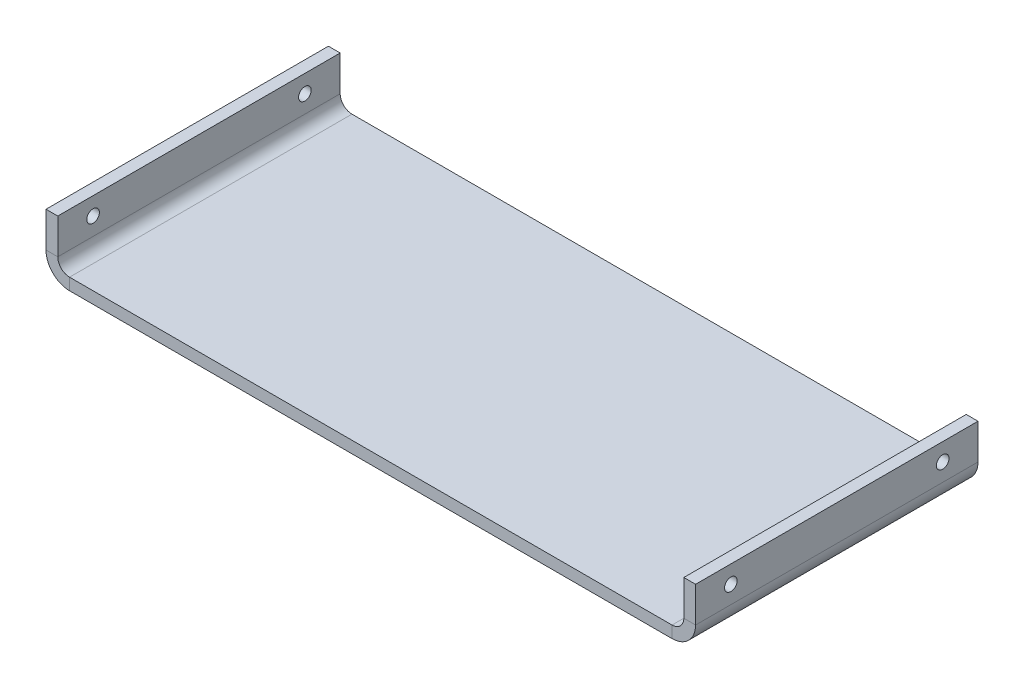
from build123d import *

# Parameters (mm, degrees)
SKETCH1_W                      = 175.26
SKETCH1_H                      = 76.2
BOSS_EXTRUDE1_DEPTH            = 3.175
EDGE_FLANGE1_STRIP_W           = 19.05
EDGE_FLANGE1_STRIP_H           = 3.175
EDGE_FLANGE1_STRIP_CUT_DEPTH   = 76.2
EDGE_FLANGE1_STRIP_2_W         = 19.05
EDGE_FLANGE1_STRIP_2_H         = 3.175
EDGE_FLANGE1_STRIP_CUT_2_DEPTH = 76.2
EDGE_FLANGE1_DEPTH             = 76.2
EDGE_FLANGE1_BEND_DEPTH        = 76.2
M3_CLEARANCE_HOLE1_D           = 3.4


# Sheet-metal steps are written as plain solids
with BuildPart() as part:
    # Sketch1 → Boss-Extrude1 (new body)
    with BuildSketch(Plane(origin=(0, 0, 0), x_dir=(1, 0, 0), z_dir=(0, 1, 0))):
        Rectangle(SKETCH1_W, SKETCH1_H)
    extrude(amount=BOSS_EXTRUDE1_DEPTH)

    # Edge-Flange1 strip (across the edge) → Edge-Flange1 strip cut (cut)
    with BuildSketch(Plane(origin=(87.63, 3.175, 38.1), x_dir=(-1, 0, 0), z_dir=(0, 0, -1))):
        with Locations((-3.175, -1.5875)):
            Rectangle(EDGE_FLANGE1_STRIP_W, EDGE_FLANGE1_STRIP_H)
    extrude(amount=EDGE_FLANGE1_STRIP_CUT_DEPTH, mode=Mode.SUBTRACT)

    # Edge-Flange1 strip 2 (across the edge) → Edge-Flange1 strip cut 2 (cut)
    with BuildSketch(Plane(origin=(-87.63, 3.175, -38.1), x_dir=(1, 0, 0), z_dir=(0, 0, 1))):
        with Locations((-3.175, -1.5875)):
            Rectangle(EDGE_FLANGE1_STRIP_2_W, EDGE_FLANGE1_STRIP_2_H)
    extrude(amount=EDGE_FLANGE1_STRIP_CUT_2_DEPTH, mode=Mode.SUBTRACT)

    # Edge-Flange1 section (across the edge) → Edge-Flange1 (add)
    with BuildSketch(Plane(origin=(87.63, 3.175, 38.1), x_dir=(-1, 0, 0), z_dir=(0, 0, -1))):
        with BuildLine():
            Line((0, 3.175), (0, 12.7))
            Line((0, 12.7), (3.175, 12.7))
            Line((3.175, 12.7), (3.175, 3.175))
            ThreePointArc((3.175, 3.175), (4.10493597, 0.92993597), (6.35, 0))
            Line((6.35, 0), (6.35, -3.175))
            ThreePointArc((6.35, -3.175), (1.859871939, -1.315128061), (0, 3.175))
        make_face()
    extrude(amount=EDGE_FLANGE1_DEPTH)

    # Edge-Flange1 section 2 (across the edge) → Edge-Flange1 bend (add)
    with BuildSketch(Plane(origin=(-87.63, 3.175, -38.1), x_dir=(1, 0, 0), z_dir=(0, 0, 1))):
        with BuildLine():
            Line((0, 3.175), (0, 12.7))
            Line((0, 12.7), (3.175, 12.7))
            Line((3.175, 12.7), (3.175, 3.175))
            ThreePointArc((3.175, 3.175), (4.10493597, 0.92993597), (6.35, 0))
            Line((6.35, 0), (6.35, -3.175))
            ThreePointArc((6.35, -3.175), (1.859871939, -1.315128061), (0, 3.175))
        make_face()
    extrude(amount=EDGE_FLANGE1_BEND_DEPTH)

    # M3 Clearance Hole1 (through all)
    with Locations(Plane(origin=(-87.63, 11.1125, -28.575), x_dir=(0, -1, 0), z_dir=(-1, 0, 0))):
        with Locations((0, 0), (0, 57.15)):
            Hole(M3_CLEARANCE_HOLE1_D / 2)


solid = part.part
